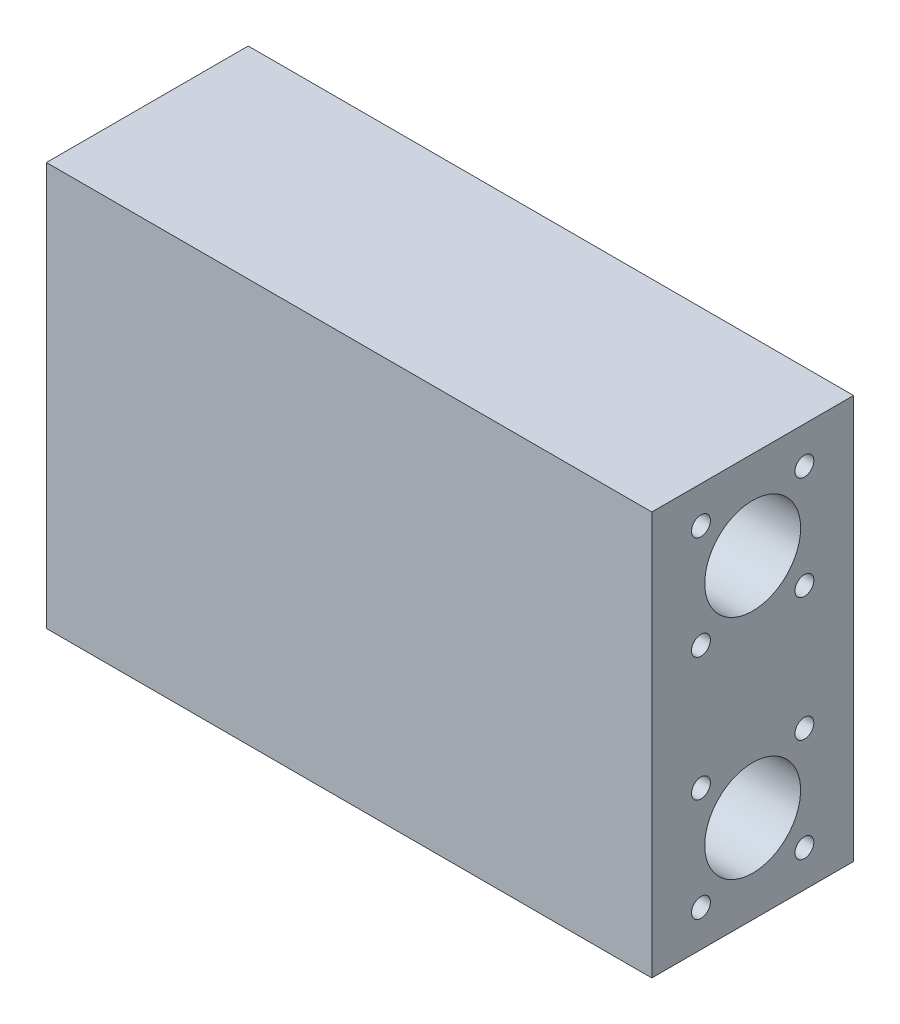
from build123d import *

# Parameters (mm, degrees)
SKETCH1_W                        = 120
SKETCH1_H                        = 80
BOSS_EXTRUDE1_DEPTH              = 40
SKETCH2_R                        = 1.85
LINEAR_BEARING_SCREW_CUTS_DEPTH  = 14
SKETCH3_R                        = 9.5
LINEAR_BEARINGS_HOLE_DEPTH       = 55
SKETCH4_R                        = 1.875
LINEAR_BEARING_SCREW_CUTS2_DEPTH = 14
CUT_EXTRUDE4_START               = -55
SKETCH5_R                        = 9.5
CUT_EXTRUDE4_DEPTH               = 55


with BuildPart() as part:
    # Sketch1 → Boss-Extrude1 (new body)
    with BuildSketch(Plane.XY):
        with Locations((60, 40)):
            Rectangle(SKETCH1_W, SKETCH1_H)
    extrude(amount=BOSS_EXTRUDE1_DEPTH)

    # Sketch2 → linear-bearing-screw-cuts (cut)
    with BuildSketch(Plane.ZY):
        with Locations((30.25, 72.75)):
            Circle(SKETCH2_R)
        with Locations((9.75, 72.75)):
            Circle(SKETCH2_R)
        with Locations((30.25, 52.25)):
            Circle(SKETCH2_R)
        with Locations((9.75, 52.25)):
            Circle(SKETCH2_R)
        with Locations((9.75, 27.75)):
            Circle(SKETCH2_R)
        with Locations((30.25, 27.75)):
            Circle(SKETCH2_R)
        with Locations((30.25, 7.25)):
            Circle(SKETCH2_R)
        with Locations((9.75, 7.25)):
            Circle(SKETCH2_R)
    extrude(amount=-LINEAR_BEARING_SCREW_CUTS_DEPTH, mode=Mode.SUBTRACT)

    # Sketch3 → linear-bearings-hole (cut)
    with BuildSketch(Plane.ZY):
        with Locations((20, 62.5)):
            Circle(SKETCH3_R)
        with Locations((20, 17.5)):
            Circle(SKETCH3_R)
    extrude(amount=-LINEAR_BEARINGS_HOLE_DEPTH, mode=Mode.SUBTRACT)

    # Sketch4 → linear-bearing-screw-cuts2 (cut)
    with BuildSketch(Plane(origin=(120, 0, 0), x_dir=(0, 0, -1), z_dir=(1, 0, 0))):
        with Locations((-9.75, 72.75)):
            Circle(SKETCH4_R)
        with Locations((-30.25, 72.75)):
            Circle(SKETCH4_R)
        with Locations((-9.75, 52.25)):
            Circle(SKETCH4_R)
        with Locations((-30.25, 52.25)):
            Circle(SKETCH4_R)
        with Locations((-30.25, 27.75)):
            Circle(SKETCH4_R)
        with Locations((-9.75, 27.75)):
            Circle(SKETCH4_R)
        with Locations((-9.75, 7.25)):
            Circle(SKETCH4_R)
        with Locations((-30.25, 7.25)):
            Circle(SKETCH4_R)
    extrude(amount=-LINEAR_BEARING_SCREW_CUTS2_DEPTH, mode=Mode.SUBTRACT)

    # Sketch5 → Cut-Extrude4 (cut)
    with BuildSketch(Plane(origin=(120, 0, 0), x_dir=(0, 0, -1), z_dir=(1, 0, 0)).offset(CUT_EXTRUDE4_START)):
        with Locations((-20, 62.5)):
            Circle(SKETCH5_R)
        with Locations((-20, 17.5)):
            Circle(SKETCH5_R)
    extrude(amount=CUT_EXTRUDE4_DEPTH, mode=Mode.SUBTRACT)


solid = part.part
